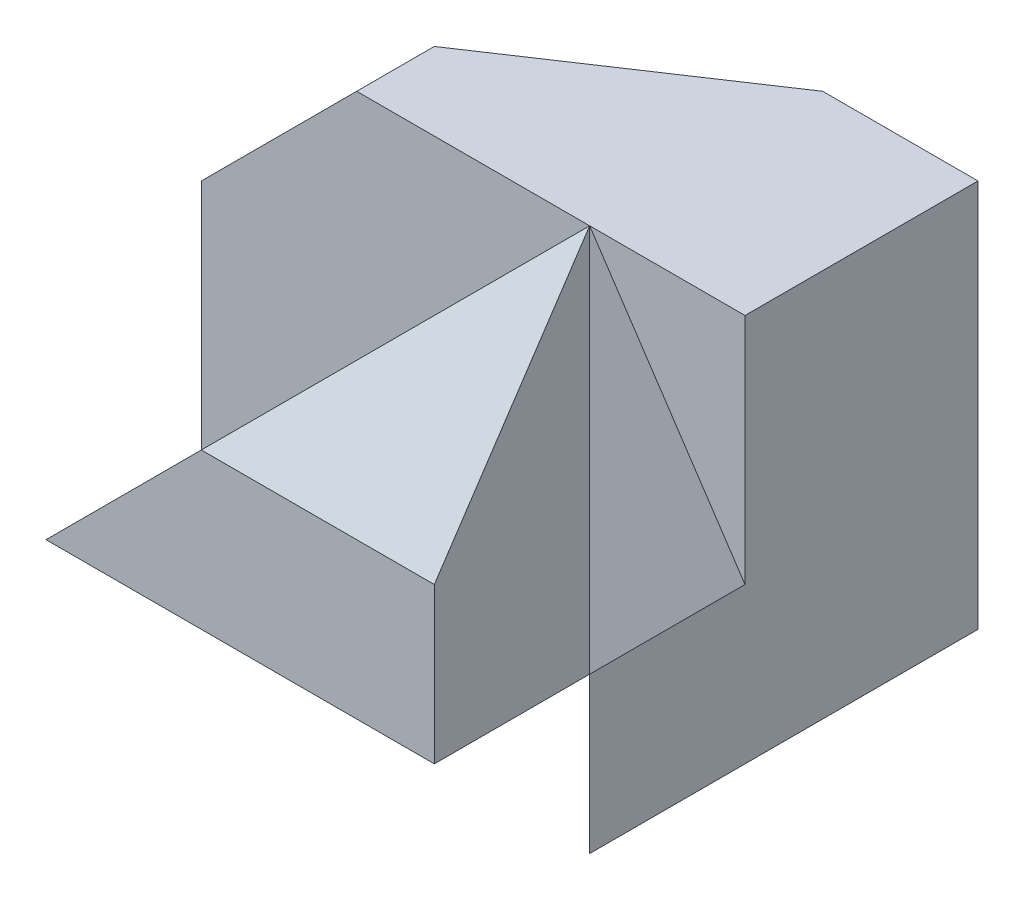
from build123d import *

# Parameters (mm, degrees)
BOSS_EXTRUDE1_DEPTH  = 50
CUT_EXTRUDE2_DEPTH   = 10
CUT_EXTRUDE3_DEPTH   = 20
SKETCH4_W            = 20
SKETCH4_H            = 50
CUT_EXTRUDE4_DEPTH   = 10
CUT_EXTRUDE5_DEPTH   = 10
CUT_EXTRUDE6_DEPTH   = 20
SKETCH7_W            = 10
SKETCH7_H            = 20
CUT_EXTRUDE7_DEPTH   = 30
BOSS_EXTRUDE2_DEPTH  = 30
CUT_EXTRUDE10_DEPTH  = 72
CUT_EXTRUDE13_DEPTH  = 10
BOSS_EXTRUDE3_DEPTH  = 10
BOSS_EXTRUDE4_DEPTH  = 29
BOSS_EXTRUDE5_DEPTH  = 29
CUT_EXTRUDE15_DEPTH  = 29
CUT_EXTRUDE17_DEPTH  = 10
BOSS_EXTRUDE6_DEPTH  = 35
CUT_EXTRUDE21_DEPTH  = 10
CUT_EXTRUDE23_DEPTH  = 10
CUT_EXTRUDE24_DEPTH  = 10
CUT_EXTRUDE25_DEPTH  = 10
BOSS_EXTRUDE13_DEPTH = 19
BOSS_EXTRUDE14_DEPTH = 19
BOSS_EXTRUDE15_DEPTH = 19
CUT_EXTRUDE27_DEPTH  = 19
CUT_EXTRUDE28_DEPTH  = 10
BOSS_EXTRUDE16_DEPTH = 35
BOSS_EXTRUDE17_DEPTH = 29
CUT_EXTRUDE29_DEPTH  = 108
BOSS_EXTRUDE18_DEPTH = 30
CUT_EXTRUDE30_DEPTH  = 10
CUT_EXTRUDE31_DEPTH  = 20
CUT_EXTRUDE34_DEPTH  = 10
CUT_EXTRUDE35_DEPTH  = 10
SKETCH51_W           = 10
SKETCH51_H           = 20
BOSS_EXTRUDE20_DEPTH = 10
BOSS_EXTRUDE21_DEPTH = 10
BOSS_EXTRUDE23_DEPTH = 50
CUT_EXTRUDE36_DEPTH  = 50
SKETCH55_W           = 20
SKETCH55_H           = 9.999
CUT_EXTRUDE41_DEPTH  = 50
SKETCH57_W           = 20
SKETCH57_H           = 9.999
BOSS_EXTRUDE24_DEPTH = 30
CUT_EXTRUDE45_DEPTH  = 10
CUT_EXTRUDE46_DEPTH  = 40
BOSS_EXTRUDE25_DEPTH = 0.0001
BOSS_EXTRUDE28_DEPTH = 10
EXTRUDE_THIN1_DEPTH  = 10
BOSS_EXTRUDE30_DEPTH = 10
CUT_EXTRUDE48_DEPTH  = 10
CUT_EXTRUDE50_DEPTH  = 10
SKETCH68_W           = 25.723933528
SKETCH68_H           = 25.413889584
BOSS_EXTRUDE39_DEPTH = 1


with BuildPart() as part:
    # Sketch1 → Boss-Extrude1 (new body)
    with BuildSketch(Plane.XY):
        Polygon((0, 0), (0, 30), (20, 50), (70, 50), (70, 0), align=None)
    extrude(amount=BOSS_EXTRUDE1_DEPTH)

    # Sketch2 → Cut-Extrude2 (cut)
    with BuildSketch(Plane.XY.offset(50)):
        Polygon((0, 30), (0, 0), (50, 50), (20, 50), align=None)
    extrude(amount=-CUT_EXTRUDE2_DEPTH, mode=Mode.SUBTRACT)

    # Sketch3 → Cut-Extrude3 (cut)
    with BuildSketch(Plane.XY.offset(50)):
        Polygon((50, 20), (20, 20), (0, 0), (50, 0), align=None)
    extrude(amount=-CUT_EXTRUDE3_DEPTH, mode=Mode.SUBTRACT)

    # Sketch4 → Cut-Extrude4 (cut)
    with BuildSketch(Plane.XY.offset(50)):
        with Locations((60, 25)):
            Rectangle(SKETCH4_W, SKETCH4_H)
    extrude(amount=-CUT_EXTRUDE4_DEPTH, mode=Mode.SUBTRACT)

    # Sketch5 → Cut-Extrude5 (cut)
    with BuildSketch(Plane.XY.offset(40)):
        Polygon((50, 50), (70, 20), (70, 50), align=None)
    extrude(amount=-CUT_EXTRUDE5_DEPTH, mode=Mode.SUBTRACT)

    # Sketch6 → Cut-Extrude6 (cut)
    with BuildSketch(Plane.ZY):
        Polygon((0, 0), (20, 30), (20, 50), (0, 50), align=None)
    extrude(amount=-CUT_EXTRUDE6_DEPTH, mode=Mode.SUBTRACT)

    # Sketch7 → Cut-Extrude7 (cut)
    with BuildSketch(Plane.ZY):
        with Locations((25, 40)):
            Rectangle(SKETCH7_W, SKETCH7_H)
    extrude(amount=-CUT_EXTRUDE7_DEPTH, mode=Mode.SUBTRACT)

    # Sketch8 → Boss-Extrude2 (add)
    with BuildSketch(Plane.ZY):
        Polygon((30, 50), (30, 0), (50, 0), (50, 20), align=None)
    extrude(amount=-BOSS_EXTRUDE2_DEPTH)

    # Sketch10 → Cut-Extrude10 (cut)
    with BuildSketch(Plane.ZY):
        Polygon((30, 50), (50, 20), (50, 50), align=None)
    extrude(amount=-CUT_EXTRUDE10_DEPTH, mode=Mode.SUBTRACT)

    # Sketch11 → Cut-Extrude13 (cut)
    with BuildSketch(Plane(origin=(0, 0, 0), x_dir=(0, 0, -1), z_dir=(1, 0, 0))):
        Polygon((-30, 50), (-30, 0), (-50, 0), (-50, 20), align=None)
    extrude(amount=CUT_EXTRUDE13_DEPTH, mode=Mode.SUBTRACT)

    # Sketch12 → Boss-Extrude3 (add)
    with BuildSketch(Plane(origin=(0, 29.230769231, 43.846153846), x_dir=(1, 0, 0), z_dir=(0, 0.5547001962252294, 0.8320502943378435))):
        Polygon((30, 6.933752453), (35, 6.933752453), (30, 0.924500327), align=None)
    extrude(amount=-BOSS_EXTRUDE3_DEPTH)

    # Sketch14 → Boss-Extrude4 (add)
    with BuildSketch(Plane.XY.offset(50)):
        Polygon((50, 0), (70, 0), (70, 20), (50, 50), align=None)
    extrude(amount=-BOSS_EXTRUDE4_DEPTH)

    # Sketch15 → Boss-Extrude5 (add)
    with BuildSketch(Plane.XY.offset(50)):
        Polygon((50, 0), (0, 0), (20, 20), (50, 20), align=None)
    extrude(amount=-BOSS_EXTRUDE5_DEPTH)

    # Sketch16 → Cut-Extrude15 (cut)
    with BuildSketch(Plane.XY.offset(50)):
        Polygon((10, 10), (20, 20), (10, 20), align=None)
    extrude(amount=-CUT_EXTRUDE15_DEPTH, mode=Mode.SUBTRACT)

    # Sketch17 → Cut-Extrude17 (cut)
    with BuildSketch(Plane.XY.offset(50)):
        Polygon((50, 20), (50, 0), (70, 0), (70, 20), (50, 50), align=None)
    extrude(amount=-CUT_EXTRUDE17_DEPTH, mode=Mode.SUBTRACT)

    # Sketch18 → Boss-Extrude6 (add)
    with BuildSketch(Plane.XY.offset(50)):
        Polygon((50, 20), (50, 50), (20, 20), align=None)
    extrude(amount=-BOSS_EXTRUDE6_DEPTH)

    # Sketch20 → Cut-Extrude21 (cut)
    with BuildSketch(Plane(origin=(0, 29.230769231, 43.846153846), x_dir=(1, 0, 0), z_dir=(0, 0.5547001962252294, 0.8320502943378435))):
        Polygon((20, -11.094003925), (50, 24.96150883), (10, 24.96150883), (10, -11.094003925), align=None)
    extrude(amount=-CUT_EXTRUDE21_DEPTH, mode=Mode.SUBTRACT)

    # Sketch26 → Cut-Extrude23 (cut)
    with BuildSketch(Plane.XY.offset(50)):
        Polygon((50, 50), (50, 20), (20, 20), align=None)
    extrude(amount=-CUT_EXTRUDE23_DEPTH, mode=Mode.SUBTRACT)

    # Sketch28 → Cut-Extrude24 (cut)
    with BuildSketch(Plane.XY.offset(40)):
        Polygon((50, 20), (50, 50), (24.615384615, 20), align=None)
    extrude(amount=-CUT_EXTRUDE24_DEPTH, mode=Mode.SUBTRACT)


with BuildPart() as cut_extrude24_piece_1:
    # of the separate pieces the step leaves, piece 1, a body of its own (cut_extrude24_pieces)
    add(part.part.solids().sort_by_distance((0, 0, 0))[0])

    # Sketch32 → Boss-Extrude13 (add)
    with BuildSketch(Plane.XY.offset(35)):
        Polygon((20, 20), (50, 20), (50, 50), align=None)
    extrude(amount=-BOSS_EXTRUDE13_DEPTH)

    # Sketch33 → Boss-Extrude14 (add)
    with BuildSketch(Plane(origin=(0, 0, 0), x_dir=(0, 0, 1), z_dir=(-0.7071067811865476, 0.7071067811865475, 0))):
        Polygon((41.679497057, 20.439625842), (37.981495748, 28.284271247), (50, 28.284271247), align=None)
    extrude(amount=-BOSS_EXTRUDE14_DEPTH)

    # Sketch34 → Boss-Extrude15 (add)
    with BuildSketch(Plane(origin=(0, 20, 0), x_dir=(1, 0, 0), z_dir=(0, 1, 0))):
        Polygon((25.547001962, -37.981495748), (20, -37.981495748), (20, -50), align=None)
    extrude(amount=-BOSS_EXTRUDE15_DEPTH)

    # Sketch36 → Cut-Extrude27 (cut)
    with BuildSketch(Plane.XY.offset(35)):
        Polygon((28.399590758, 24.472243623), (24.615384615, 20), (8.952966546, 20), (8.952966546, 24.472243623), align=None)
    extrude(amount=CUT_EXTRUDE27_DEPTH, mode=Mode.SUBTRACT)

    # Sketch37 → Cut-Extrude28 (cut)
    with BuildSketch(Plane.XY.offset(35)):
        Polygon((24.472243623, 24.472243623), (20, 20), (10, 20), (10, 24.472243623), align=None)
    extrude(amount=-CUT_EXTRUDE28_DEPTH, mode=Mode.SUBTRACT)

    # Sketch39 → Boss-Extrude16 (add)
    with BuildSketch(Plane.ZY.offset(-30)):
        Polygon((30, 31.972243623), (30, 50), (21.679497057, 44.452998038), align=None)
    extrude(amount=-BOSS_EXTRUDE16_DEPTH)

    # Sketch41 → Boss-Extrude17 (add)
    with BuildSketch(Plane(origin=(20, 0, 0), x_dir=(0, 0, -1), z_dir=(1, 0, 0))):
        Polygon((-30, 0), (-50, 0), (-50, 20), (-30, 50), align=None)
    extrude(amount=BOSS_EXTRUDE17_DEPTH)

    # Sketch42 → Cut-Extrude29 (cut)
    with BuildSketch(Plane.ZY):
        Polygon((50, 50), (50, 20), (30, 50), align=None)
    extrude(amount=-CUT_EXTRUDE29_DEPTH, mode=Mode.SUBTRACT)

    # Sketch43 → Boss-Extrude18 (add)
    with BuildSketch(Plane.ZY.offset(-20)):
        Polygon((30, 50), (30, 20), (50, 20), align=None)
    extrude(amount=-BOSS_EXTRUDE18_DEPTH)

    # Sketch44 → Cut-Extrude30 (cut)
    with BuildSketch(Plane.ZY.offset(-10)):
        Polygon((30, 24.472243623), (30, 31.972243623), (35, 24.472243623), align=None)
    extrude(amount=-CUT_EXTRUDE30_DEPTH, mode=Mode.SUBTRACT)

    # Sketch45 → Cut-Extrude31 (cut)
    with BuildSketch(Plane.XY.offset(50)):
        Polygon((20, 20), (50, 50), (20, 50), align=None)
    extrude(amount=-CUT_EXTRUDE31_DEPTH, mode=Mode.SUBTRACT)

    # Sketch48 → Cut-Extrude34 (cut)
    with BuildSketch(Plane.XY.offset(40)):
        Polygon((70, 0), (70, 20), (60, 35), (50, 35), (50, 0), align=None)
        Polygon((50, 50), (50, 35), (60, 35), align=None)
    extrude(amount=-CUT_EXTRUDE34_DEPTH, mode=Mode.SUBTRACT)

    # Sketch49 → Cut-Extrude35 (cut)
    with BuildSketch(Plane.XY.offset(30)):
        Polygon((50, 50), (70, 20), (70, 50), align=None)
    extrude(amount=-CUT_EXTRUDE35_DEPTH, mode=Mode.SUBTRACT)

    # Sketch51 → Boss-Extrude20 (add)
    with BuildSketch(Plane.XY.offset(20)):
        with Locations((25, 40)):
            Rectangle(SKETCH51_W, SKETCH51_H)
        Polygon((20, 30), (0, 30), (20, 50), align=None)
    extrude(amount=BOSS_EXTRUDE20_DEPTH)

    # Sketch52 → Boss-Extrude21 (add)
    with BuildSketch(Plane.XY.offset(30)):
        Polygon((10, 10), (24.472243623, 24.472243623), (10, 24.472243623), align=None)
    extrude(amount=-BOSS_EXTRUDE21_DEPTH)

    # Sketch53 → Boss-Extrude23 (add)
    with BuildSketch(Plane(origin=(0, 0, 0), x_dir=(1, 0, 0), z_dir=(0, 1, 0))):
        Polygon((70, -30), (70, -50), (50, -30), align=None)
    extrude(amount=BOSS_EXTRUDE23_DEPTH)

    # Sketch54 → Cut-Extrude36 (cut)
    with BuildSketch(Plane(origin=(0, 0, 30), x_dir=(-1, 0, 0), z_dir=(0, 0, -1))):
        Polygon((-70, 20), (-50, 50), (-70, 50), align=None)
    extrude(amount=-CUT_EXTRUDE36_DEPTH, mode=Mode.SUBTRACT)

    # Sketch55 → Cut-Extrude41 (cut)
    with BuildSketch(Plane(origin=(0, 20, 0), x_dir=(1, 0, 0), z_dir=(0, 1, 0))):
        with Locations((60, -24.9995)):
            Rectangle(SKETCH55_W, SKETCH55_H)
    extrude(amount=CUT_EXTRUDE41_DEPTH, mode=Mode.SUBTRACT)

    # Sketch57 → Boss-Extrude24 (add)
    with BuildSketch(Plane(origin=(0, 20, 0), x_dir=(1, 0, 0), z_dir=(0, 1, 0))):
        with Locations((60, -24.9995)):
            Rectangle(SKETCH57_W, SKETCH57_H)
    extrude(amount=BOSS_EXTRUDE24_DEPTH)

    # Sketch58 → Cut-Extrude45 (cut)
    with BuildSketch(Plane(origin=(0, 50, 0), x_dir=(1, 0, 0), z_dir=(0, 1, 0))):
        Polygon((20, -20), (50, 0), (20, 0), align=None)
    extrude(amount=-CUT_EXTRUDE45_DEPTH, mode=Mode.SUBTRACT)

    # Sketch59 → Cut-Extrude46 (cut)
    with BuildSketch(Plane(origin=(0, 40, 0), x_dir=(1, 0, 0), z_dir=(0, 1, 0))):
        Polygon((20, 0), (20, -20), (50, 0), align=None)
    extrude(amount=-CUT_EXTRUDE46_DEPTH, mode=Mode.SUBTRACT)

    # Sketch60 → Boss-Extrude25 (add)
    with BuildSketch(Plane.XZ):
        Polygon((20, 0), (50, 0), (20, 20), align=None)
    extrude(amount=-BOSS_EXTRUDE25_DEPTH)

    # Sketch61 → Boss-Extrude28 (add)
    with BuildSketch(Plane(origin=(0, 3.0769e-05, -4.6154e-05), x_dir=(1, 0, 0), z_dir=(0, -0.5547014763049025, 0.8320494409499725))):
        Polygon((50, 8.3205e-05), (20, 36.055512755), (20, 8.3205e-05), align=None)
    extrude(amount=BOSS_EXTRUDE28_DEPTH)

    # Sketch62 → Extrude-Thin1 (add)
    with BuildSketch(Plane(origin=(0, 0, 0), x_dir=(-0.9999999999968847, 1.384610769127148e-06, -2.0769161536907223e-06), z_dir=(2.496142562323782e-06, 0.5547001962235016, -0.8320502943352512))):
        Polygon((0, 36.055512755), (-4.722952829, 0), (-50, 8.3205e-05), (-49.999981623, 10.000083205), (-13.498467783, 10.000016127), (-9.915295125, 37.354328597), align=None)
    extrude(amount=-EXTRUDE_THIN1_DEPTH)

    # Sketch63 → Boss-Extrude30 (add)
    with BuildSketch(Plane(origin=(0, 0, 0), x_dir=(-0.9999999999993847, -6.153857514652135e-07, 9.230773964263176e-07), z_dir=(-1.109401416485302e-06, 0.5547007082562057, -0.8320499529828923))):
        Polygon((-20, 36.055512755), (0, 0), (-50, 8.3205e-05), align=None)
    extrude(amount=-BOSS_EXTRUDE30_DEPTH)


with BuildPart() as cut_extrude24_piece_2:
    # of the separate pieces the step leaves, piece 2, a body of its own (cut_extrude24_pieces)
    add(part.part.solids().sort_by_distance((35, 35, 40))[0])

    # Sketch30 → Cut-Extrude25 (cut)
    with BuildSketch(Plane(origin=(4.482758621, -3.793103448, 0), x_dir=(0, 0, 1), z_dir=(-0.7633862853691147, 0.6459422414661738, 0))):
        Polygon((30, 70.466426342), (40, 70.466426342), (40, 31.16784242), align=None)
    extrude(amount=CUT_EXTRUDE25_DEPTH, mode=Mode.SUBTRACT)


with BuildPart() as boss_extrude30_kept_piece:
    # of the separate pieces the step leaves, the one the design keeps (boss_extrude30_pieces_kept)
    add(cut_extrude24_piece_1.part.solids().sort_by_distance((0, 0, 0))[0])

    # Sketch64 → Cut-Extrude48 (cut)
    with BuildSketch(Plane(origin=(0, 0, 0), x_dir=(-1, 0, 0), z_dir=(0, -1, 0))):
        Polygon((-49.999962787, -12.018654251), (-50.000000002, -0.000150001), (0, 0), (-3.698015816, -12.018504252), align=None)
    extrude(amount=CUT_EXTRUDE48_DEPTH, mode=Mode.SUBTRACT)


with BuildPart() as cut_extrude48_piece_1:
    # of the separate pieces the step leaves, piece 1, a body of its own (cut_extrude48_pieces_kept)
    add(boss_extrude30_kept_piece.part.solids().sort_by_distance((0, 30, 20))[0])

    # Sketch68 → Boss-Extrude39 (add)
    with BuildSketch(Plane.XZ):
        with Locations((25.237412158, 15.000389629)):
            Rectangle(SKETCH68_W, SKETCH68_H)
    extrude(amount=-BOSS_EXTRUDE39_DEPTH)


with BuildPart() as cut_extrude48_piece_2:
    # of the separate pieces the step leaves, piece 2, a body of its own (cut_extrude48_pieces_kept)
    add(boss_extrude30_kept_piece.part.solids().sort_by_distance((1.1094e-05, -5.547007083, 8.32049953))[0])

    # Sketch67 → Cut-Extrude50 (cut)
    with BuildSketch(Plane(origin=(0, 0, 0), x_dir=(0.2443048636302998, -0.11275589430574709, 0.9631205749572023), z_dir=(-0.8744746321945025, 0.4036029726775825, 0.2690701731781287))):
        Polygon((8.639104746, -5.03645403), (0, 0), (12.478711974, 1.54968154), align=None)
    extrude(amount=-CUT_EXTRUDE50_DEPTH, mode=Mode.SUBTRACT)


solid = cut_extrude48_piece_1.part
